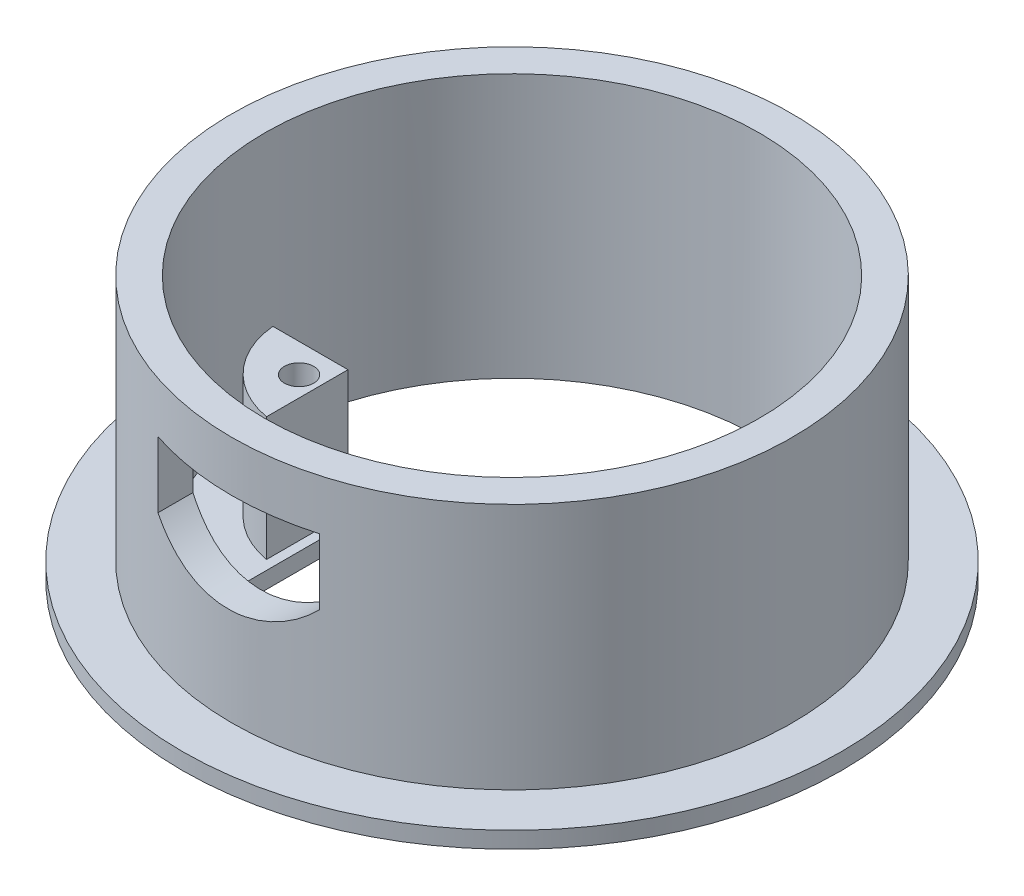
from build123d import *

# Parameters (mm, degrees)
SKETCH1_R           = 40
SKETCH1_R_2         = 30
BOSS_EXTRUDE1_DEPTH = 2
SKETCH2_R           = 34
SKETCH2_R_2         = 30
BOSS_EXTRUDE2_DEPTH = 30
BOSS_EXTRUDE3_DEPTH = 2
CUT_EXTRUDE1_DEPTH  = 7
BOSS_EXTRUDE4_DEPTH = 15
SKETCH12_R          = 1.775
CUT_EXTRUDE2_DEPTH  = 9
CUT_EXTRUDE3_DEPTH  = 10


with BuildPart() as part:
    # Sketch1 → Boss-Extrude1 (new body)
    with BuildSketch(Plane(origin=(0, 0, 0), x_dir=(1, 0, 0), z_dir=(0, 1, 0))):
        Circle(SKETCH1_R)
        Circle(SKETCH1_R_2, mode=Mode.SUBTRACT)
    extrude(amount=BOSS_EXTRUDE1_DEPTH)

    # Sketch2 → Boss-Extrude2 (add)
    with BuildSketch(Plane(origin=(0, 2, 0), x_dir=(1, 0, 0), z_dir=(0, 1, 0))):
        Circle(SKETCH2_R)
        Circle(SKETCH2_R_2, mode=Mode.SUBTRACT)
    extrude(amount=BOSS_EXTRUDE2_DEPTH)

    # Sketch9 → Boss-Extrude3 (add)
    with BuildSketch(Plane(origin=(0, 0, 0), x_dir=(1, 0, 0), z_dir=(0, 1, 0))):
        with BuildLine():
            Line((-29.865737826, -2.835084495), (29.865737826, -2.835084495))
            ThreePointArc((29.865737826, -2.835084495), (20.185978613, -22.192932826), (0, -30))
            ThreePointArc((0, -30), (-20.185978613, -22.192932826), (-29.865737826, -2.835084495))
        make_face()
    extrude(amount=BOSS_EXTRUDE3_DEPTH)

    # Sketch10 → Cut-Extrude1 (cut)
    with BuildSketch(Plane.XY.offset(35)):
        with BuildLine():
            Line((-10.668263465, 25.889544809), (9.331736535, 25.889544809))
            Line((9.331736535, 25.889544809), (9.331736535, 17.889544809))
            ThreePointArc((9.331736535, 17.889544809), (-0.668263465, 13.747409185), (-10.668263465, 17.889544809))
            Line((-10.668263465, 17.889544809), (-10.668263465, 25.889544809))
        make_face()
    extrude(amount=-CUT_EXTRUDE1_DEPTH, mode=Mode.SUBTRACT)

    # Sketch11 → Boss-Extrude4 (add)
    with BuildSketch(Plane(origin=(0, 2, 0), x_dir=(1, 0, 0), z_dir=(0, 1, 0))):
        with BuildLine():
            Line((-24.173456416, -4.835084495), (-15.0625297, -4.835084495))
            Line((-15.0625297, -4.835084495), (-15.0625297, -14.717703762))
            ThreePointArc((-15.0625297, -14.717703762), (-21.294330348, -11.321833226), (-24.173456416, -4.835084495))
        make_face()
        with BuildLine():
            Line((24.173456416, -4.835084495), (15.0625297, -4.835084495))
            Line((15.0625297, -4.835084495), (15.0625297, -14.717703762))
            ThreePointArc((15.0625297, -14.717703762), (21.294330348, -11.321833226), (24.173456416, -4.835084495))
        make_face()
    extrude(amount=BOSS_EXTRUDE4_DEPTH)

    # Sketch12 → Cut-Extrude2 (cut)
    with BuildSketch(Plane(origin=(0, 17, 0), x_dir=(1, 0, 0), z_dir=(0, 1, 0))):
        with Locations((-17.5, -8.335084495)):
            Circle(SKETCH12_R)
        with Locations((17.5, -8.335084495)):
            Circle(SKETCH12_R)
    extrude(amount=-CUT_EXTRUDE2_DEPTH, mode=Mode.SUBTRACT)

    # Sketch13 → Cut-Extrude3 (cut)
    with BuildSketch(Plane(origin=(0, 2, 0), x_dir=(1, 0, 0), z_dir=(0, 1, 0))):
        with BuildLine():
            Line((-13.918444603, -20.880652704), (-13.918444603, 1.119347296))
            Line((-13.918444603, 1.119347296), (14.081555397, 1.119347296))
            Line((14.081555397, 1.119347296), (14.081555397, -20.880652704))
            ThreePointArc((14.081555397, -20.880652704), (0.081555397, -27.349053727), (-13.918444603, -20.880652704))
        make_face()
    extrude(amount=-CUT_EXTRUDE3_DEPTH, mode=Mode.SUBTRACT)


solid = part.part
